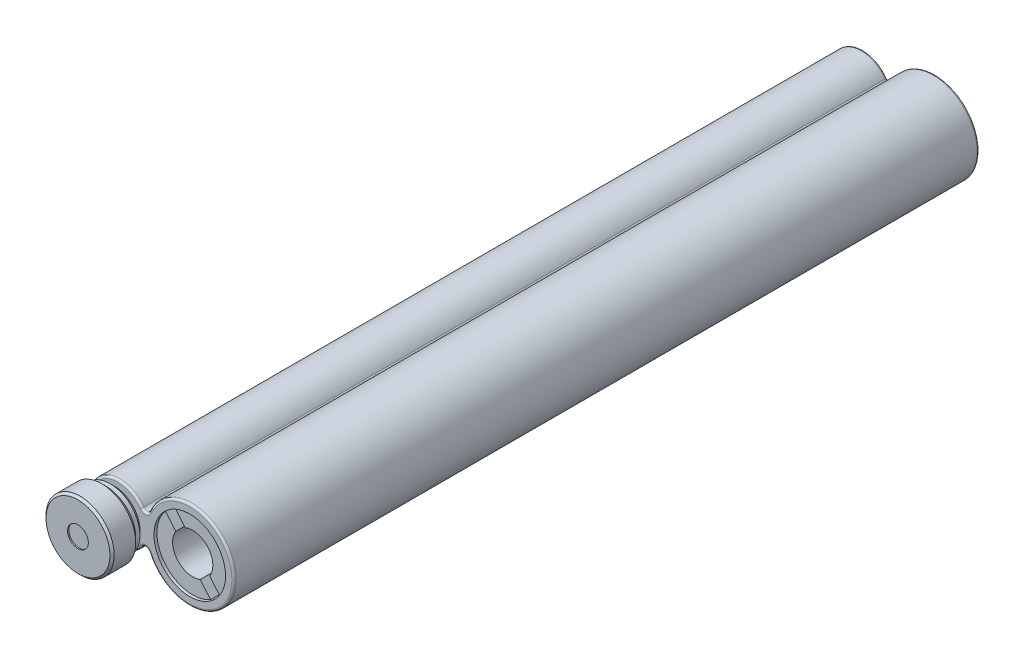
from build123d import *

# Parameters (mm, degrees)
EXTRUDE1_DEPTH = 88
FILLET1_R      = 1
SKETCH4_R      = 8.45
EXTRUDE2_DEPTH = 0.7
EXTRUDE3_DEPTH = 2.5
SKETCH6_R      = 4.75
EXTRUDE4_DEPTH = 84.8
CHAMFER1_SIZE  = 1
CHAMFER2_SIZE  = 0.5
SKETCH7_R      = 5.75
EXTRUDE5_DEPTH = 0.1
EXTRUDE6_DEPTH = 9
FILLET2_R      = 0.5


with BuildPart() as part:
    # Sketch2 → Extrude1 (new, symmetric)
    with BuildSketch(Plane.XY):
        with BuildLine():
            ThreePointArc((-10.291176471, -1.814989491), (10.45, 0), (-10.291176471, 1.814989491))
            ThreePointArc((-10.291176471, 1.814989491), (-23.95, 0), (-10.291176471, -1.814989491))
        make_face()
    extrude(amount=EXTRUDE1_DEPTH, both=True)

    # Fillet1
    fillet1_edges = [part.edges().sort_by_distance(p)[0] for p in [
        (-10.291176471, 1.814989491, 0),
        (-10.291176471, -1.814989491, 0),
    ]]
    fillet(fillet1_edges, radius=FILLET1_R)

    # Sketch3 → Revolve1 (revolve)
    with BuildSketch(Plane(origin=(0, 0, 0), x_dir=(1, 0, 0), z_dir=(0, 1, 0))):
        Polygon((-20, -88), (-20, -88.8), (-24.05, -88.8), (-24.05, -90.8), (-25.05, -90.8), (-25.05, -97.4), (-19.45, -97.4), (-19.45, -97.1), (-17, -97.1), (-17, -88), align=None)
    revolve(axis=Axis((-17, 0, -88.93192935), (0, 0, 1)))

    # Sketch4 → Extrude2 (cut)
    with BuildSketch(Plane.XY.offset(88)):
        Circle(SKETCH4_R)
    extrude2 = extrude(amount=-EXTRUDE2_DEPTH, mode=Mode.SUBTRACT)

    # Sketch5 → Extrude3 (cut)
    with BuildSketch(Plane.XY.offset(87.3)):
        with BuildLine():
            Line((-6.439880123, 5.470872325), (-4.008084609, 2.549069981))
            ThreePointArc((-4.008084609, 2.549069981), (-3.650918419, -3.038633689), (1.779102837, -4.404235813))
            Line((1.779102837, -4.404235813), (4.210898352, -7.326038157))
            ThreePointArc((4.210898352, -7.326038157), (5.405569405, -6.494791714), (6.439880123, -5.470872325))
            Line((6.439880123, -5.470872325), (4.008084609, -2.549069981))
            ThreePointArc((4.008084609, -2.549069981), (3.650918419, 3.038633689), (-1.779102837, 4.404235813))
            Line((-1.779102837, 4.404235813), (-4.210898352, 7.326038157))
            ThreePointArc((-4.210898352, 7.326038157), (-5.405569405, 6.494791714), (-6.439880123, 5.470872325))
        make_face()
    extrude3 = extrude(amount=-EXTRUDE3_DEPTH, mode=Mode.SUBTRACT)

    # Sketch6 → Extrude4 (cut)
    with BuildSketch(Plane.XY.offset(84.8)):
        Circle(SKETCH6_R)
    extrude4 = extrude(amount=-EXTRUDE4_DEPTH, mode=Mode.SUBTRACT)

    # Mirror1: Extrude2, Extrude3, Extrude4 across plane
    add(extrude2.mirror(Plane.XY), mode=Mode.SUBTRACT)
    add(extrude3.mirror(Plane.XY), mode=Mode.SUBTRACT)
    add(extrude4.mirror(Plane.XY), mode=Mode.SUBTRACT)

    # Chamfer1
    chamfer1_edges = [part.edges().sort_by_distance(p)[0] for p in [
        (-9.95, 0, 88.8),
        (-8.95, 0, 90.8),
    ]]
    chamfer(chamfer1_edges, length=CHAMFER1_SIZE - 0.0001)  # a hair under: the kernel refuses the full size

    # Chamfer2
    chamfer2_edges = [part.edges().sort_by_distance(p)[0] for p in [
        (-8.95, 0, 97.4),
    ]]
    chamfer(chamfer2_edges, length=CHAMFER2_SIZE)

    # Sketch7 → Extrude5 (cut)
    with BuildSketch(Plane(origin=(0, 0, -88), x_dir=(-1, 0, 0), z_dir=(0, 0, -1))):
        with Locations((17, 0)):
            Circle(SKETCH7_R)
    extrude(amount=-EXTRUDE5_DEPTH, mode=Mode.SUBTRACT)

    # Sketch8 → Extrude6 (cut)
    with BuildSketch(Plane(origin=(0, 0, -87.9), x_dir=(-1, 0, 0), z_dir=(0, 0, -1))):
        Polygon((19.383629921, 2.513624554), (16.014952241, 3.321096342), (13.63132232, 0.807471788), (14.616370079, -2.513624554), (17.985047759, -3.321096342), (20.36867768, -0.807471788), align=None)
    extrude(amount=-EXTRUDE6_DEPTH, mode=Mode.SUBTRACT)

    # Fillet2
    fillet2_edges = [part.edges().sort_by_distance(p)[0] for p in [
        (-23.95, 0, -88),
        (-23.95, 0, 88),
        (-10.396212718, -3.578308658, -88),
        (-10.396212718, -3.578308658, 88),
        (-10.396212718, 3.578308658, -88),
        (-10.396212718, 3.578308658, 88),
        (10.45, 0, -88),
        (10.45, 0, 88),
    ]]
    fillet(fillet2_edges, radius=FILLET2_R)


solid = part.part
